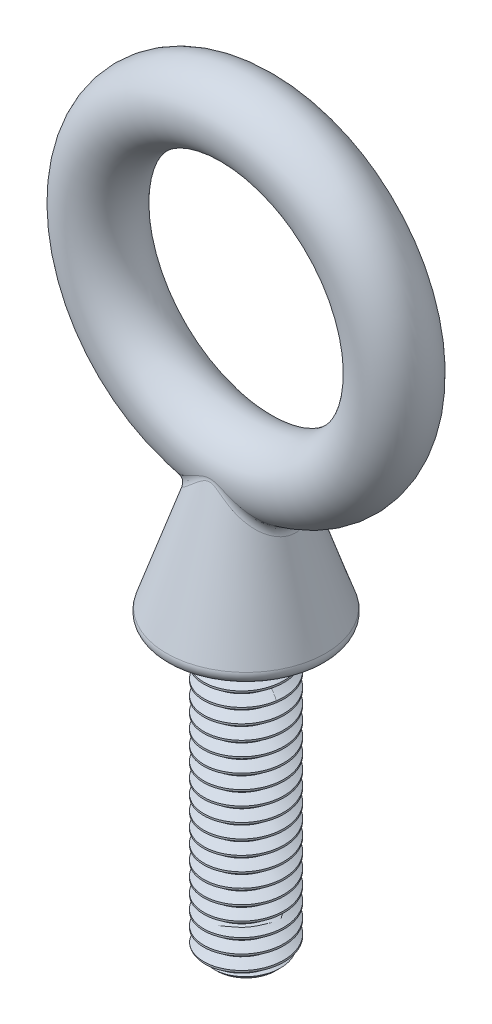
from build123d import *
from build123d.topology import SkipClean

# Parameters (mm, degrees)
BOSS_EXTRUDE1_START = -28.575
SKETCH2_R           = 3.96875
BOSS_EXTRUDE1_DEPTH = 28.575
CUT_SWEEP1_PITCH    = 1.411111111
SKETCH5_OUTSIDE_W   = 76.32
SKETCH5_OUTSIDE_H   = 76.32
SKETCH5_OUTSIDE_R   = 2.899449189
CUT_EXTRUDE1_DEPTH  = 30.120999046
CUT_EXTRUDE1_DRAFT  = -45
SKETCH6_R           = 3.571875
FILLET1_R           = 0.89296875


with BuildPart() as part:
    # Sketch2 → Boss-Extrude1 (new body)
    with BuildSketch(Plane(origin=(0, 0, 0), x_dir=(1, 0, 0), z_dir=(0, 1, 0)).offset(BOSS_EXTRUDE1_START)):
        with Locations(Location((0, 0, 0), (0, 0, 270))):
            Circle(SKETCH2_R)
    extrude(amount=-BOSS_EXTRUDE1_DEPTH)

    # Cut-Sweep1: the profile of Sketch4 screwed along a right-hand helix of 21.25 turns, 8 arcs to a turn; built about Z, then put on its axis
    cut_sweep1_z = Axis((0, 0, 0), (0, 0, 1))
    cut_sweep1_corners = [(4.045128629, 0, 0.044097222), (3.052206448, 0, -0.529166667), (3.052206448, 0, -0.705555556), (4.045128629, 0, -1.278819444)]
    with BuildLine(mode=Mode.PRIVATE) as cut_sweep1_profile:
        Line(cut_sweep1_corners[0], cut_sweep1_corners[1])
        Line(cut_sweep1_corners[1], cut_sweep1_corners[2])
        Line(cut_sweep1_corners[2], cut_sweep1_corners[3])
        Line(cut_sweep1_corners[3], cut_sweep1_corners[0])
    cut_sweep1_cap = Face(cut_sweep1_profile.wire())
    cut_sweep1_turn_angles = [0, 22.5, 45, 67.5, 90, 112.5, 135, 157.5, 180, 202.5, 225, 247.5, 270, 292.5, 315, 337.5, 360]
    cut_sweep1_turn_weights = [1, 0.9238795325112867, 1, 0.9238795325112867, 1, 0.9238795325112867, 1, 0.9238795325112867, 1, 0.9238795325112867, 1, 0.9238795325112867, 1, 0.9238795325112867, 1, 0.9238795325112867, 1]
    cut_sweep1_turn_rails = [Edge.make_bspline([Vector(p[0], p[1], 0).rotate(cut_sweep1_z, cut_sweep1_turn_angles[k]) / cut_sweep1_turn_weights[k] + Vector(0, 0, p[2] + CUT_SWEEP1_PITCH * cut_sweep1_turn_angles[k] / 360) for k in range(17)], [0, 0, 0, 1, 1, 2, 2, 3, 3, 4, 4, 5, 5, 6, 6, 7, 7, 8, 8, 8], 2, cut_sweep1_turn_weights) for p in cut_sweep1_corners]
    cut_sweep1_turn_sides = [Face.make_surface_from_curves(cut_sweep1_turn_rails[p[0]], cut_sweep1_turn_rails[p[1]]) for p in [(0, 1), (1, 2), (2, 3), (3, 0)]]
    cut_sweep1_last_angles = [7560, 7582.5, 7605, 7627.5, 7650]
    cut_sweep1_last_weights = [1, 0.9238795325112867, 1, 0.9238795325109254, 1]
    cut_sweep1_last_rails = [Edge.make_bspline([Vector(p[0], p[1], 0).rotate(cut_sweep1_z, cut_sweep1_last_angles[k]) / cut_sweep1_last_weights[k] + Vector(0, 0, p[2] + CUT_SWEEP1_PITCH * cut_sweep1_last_angles[k] / 360) for k in range(5)], [0, 0, 0, 1, 1, 2, 2, 2], 2, cut_sweep1_last_weights) for p in cut_sweep1_corners]
    cut_sweep1_last_sides = [Face.make_surface_from_curves(cut_sweep1_last_rails[p[0]], cut_sweep1_last_rails[p[1]]) for p in [(0, 1), (1, 2), (2, 3), (3, 0)]]
    cut_sweep1 = Plane(origin=(0, -57.15, 0), x_dir=(1, 0, 0), z_dir=(0, 1, 0)) * Solid(Shell([*[p.moved(Location((0, 0, CUT_SWEEP1_PITCH * i))) for i in range(21) for p in cut_sweep1_turn_sides], *cut_sweep1_last_sides, cut_sweep1_cap, cut_sweep1_cap.rotate(cut_sweep1_z, 7650).moved(Location((0, 0, CUT_SWEEP1_PITCH * 7650 / 360)))]))
    add(cut_sweep1, mode=Mode.SUBTRACT)


with BuildPart() as cut_extrude1_tool:
    # Sketch5 outside → Cut-Extrude1 (with draft: the straight prism first)
    with BuildSketch(Plane.XZ.offset(57.15)):
        Rectangle(SKETCH5_OUTSIDE_W, SKETCH5_OUTSIDE_H)
        Circle(SKETCH5_OUTSIDE_R, mode=Mode.SUBTRACT)
    extrude(amount=-CUT_EXTRUDE1_DEPTH)
    # Cut-Extrude1: the draft: its side faces are tilted about the plane it starts from
    cut_extrude1_sides = [cut_extrude1_tool.faces().sort_by_distance(p)[0] for p in [
        (0, -42.089500477, -38.16),
        (38.16, -42.089500477, 0),
        (0, -42.089500477, 38.16),
        (-38.16, -42.089500477, 0),
        (-2.899449189, -42.089500477, 0),
    ]]
    draft(cut_extrude1_sides, Plane.XZ.offset(57.15), CUT_EXTRUDE1_DRAFT)


with BuildPart() as part_1:
    add(part.part)

    # Cut-Extrude1: cut by cut_extrude1_tool
    add(cut_extrude1_tool.part, mode=Mode.SUBTRACT)



with BuildPart() as body_2:
    # Sketch6 → Revolve1 (revolve)
    with BuildSketch(Plane(origin=(0, 0, 0), x_dir=(0, 0, -1), z_dir=(1, 0, 0)), mode=Mode.PRIVATE) as revolve1_sk:
        with Locations((0, 14.684375)):
            Circle(SKETCH6_R)
    revolve(revolve1_sk.sketch.rotate(Axis((0, 0, -7.63984375), (0, 0, 1)), 90), axis=Axis((0, 0, -7.63984375), (0, 0, 1)))


with BuildPart() as part_2:
    with SkipClean():  # the faces are left unmerged after this step: merging them gives an invalid solid
        add(part_1.part)

        add(body_2.part)  # Revolve2 merges body 2
        # Sketch8 → Revolve2 (revolve)
        with BuildSketch(Plane.XY, mode=Mode.PRIVATE) as revolve2_sk:
            with BuildLine():
                Line((0, -28.575), (0, -14.684375))
                Line((0, -14.684375), (-3.571875, -14.684375))
                Line((-3.571875, -14.684375), (-7.890038138, -27.394783465))
                ThreePointArc((-7.890038138, -27.394783465), (-7.770443257, -28.202074466), (-7.04453125, -28.575))
                Line((-7.04453125, -28.575), (0, -28.575))
            make_face()
        revolve(revolve2_sk.sketch.rotate(Axis((0, -28.575, 0), (0, 1, 0)), 180), axis=Axis((0, -28.575, 0), (0, 1, 0)))

    # Fillet1
    fillet1_edges = [part_2.edges().sort_by_distance(p)[0] for p in [
        (3.022829421, -16.497334309, 2.898304409),
    ]]
    fillet(fillet1_edges, radius=FILLET1_R)


solid = part_2.part
